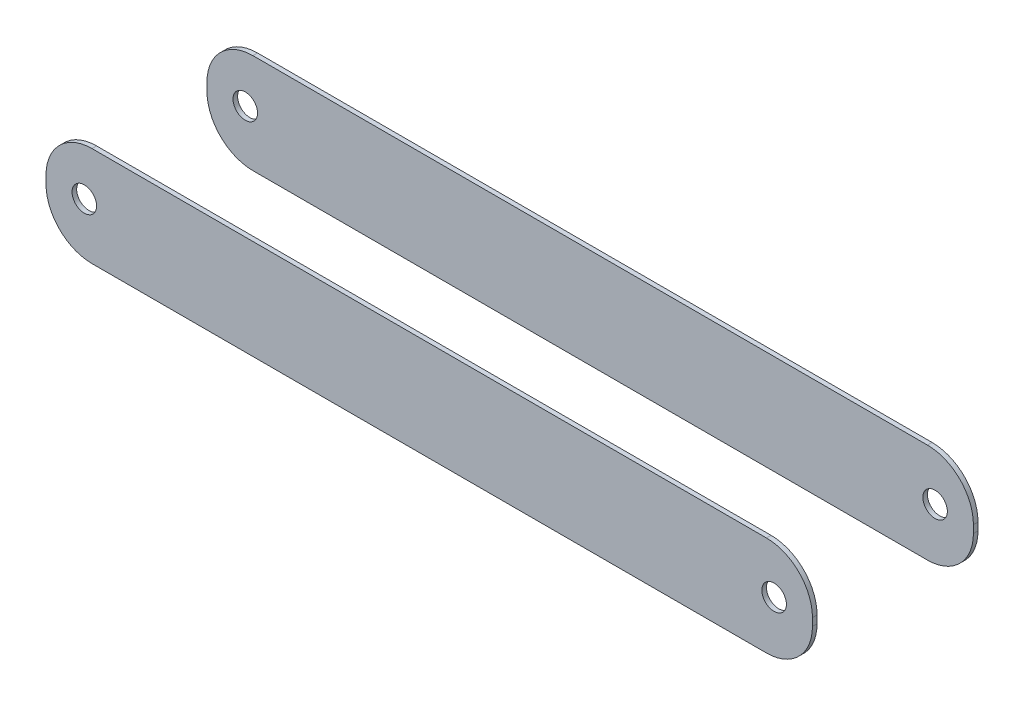
from build123d import *

# Parameters (mm, degrees)
SKETCH1_W           = 500
SKETCH1_H           = 108
BOSS_EXTRUDE1_DEPTH = 65
SKETCH3_W           = 500
SKETCH3_H           = 102
CUT_EXTRUDE1_DEPTH  = 158
SKETCH4_R           = 8
CUT_EXTRUDE2_DEPTH  = 158
FILLET1_R           = 30
FILLET3_R           = 30


with BuildPart() as part:
    # Sketch1 → Boss-Extrude1 (new body)
    with BuildSketch(Plane(origin=(0, 0, 0), x_dir=(1, 0, 0), z_dir=(0, 1, 0))):
        with Locations((16.180492252, 90.484958979)):
            Rectangle(SKETCH1_W, SKETCH1_H)
    extrude(amount=BOSS_EXTRUDE1_DEPTH)

    # Sketch3 → Cut-Extrude1 (cut)
    with BuildSketch(Plane.XZ):
        with Locations((16.180492252, -90.484958979)):
            Rectangle(SKETCH3_W, SKETCH3_H)
    extrude(amount=-CUT_EXTRUDE1_DEPTH, mode=Mode.SUBTRACT)


with BuildPart() as cut_extrude1_piece_1:
    # of the separate pieces the step leaves, piece 1, a body of its own (cut_extrude1_pieces)
    add(part.part.solids().sort_by_distance((-233.819507748, 0, -144.484958979))[0])


with BuildPart() as cut_extrude1_piece_2:
    # of the separate pieces the step leaves, piece 2, a body of its own (cut_extrude1_pieces)
    add(part.part.solids().sort_by_distance((-233.819507748, 0, -36.484958979))[0])


with BuildPart() as cut_extrude2_tool:
    # Sketch4 → Cut-Extrude2 (new body)
    with BuildSketch(Plane.XY.offset(-36.484958979)):
        with Locations((-208.819507748, 34)):
            Circle(SKETCH4_R)
        with Locations((241.180492252, 34)):
            Circle(SKETCH4_R)
    extrude(amount=-CUT_EXTRUDE2_DEPTH)


with BuildPart() as cut_extrude1_piece_1_1:
    add(cut_extrude1_piece_1.part)

    # Cut-Extrude2: cut by cut_extrude2_tool
    add(cut_extrude2_tool.part, mode=Mode.SUBTRACT)

    # Fillet1
    fillet1_edges = [cut_extrude1_piece_1_1.edges().sort_by_distance(p)[0] for p in [
        (-233.819507748, 65, -142.984958979),
        (-233.819507748, 0, -142.984958979),
        (266.180492252, 0, -142.984958979),
        (266.180492252, 65, -142.984958979),
    ]]
    fillet(fillet1_edges, radius=FILLET1_R)


with BuildPart() as cut_extrude1_piece_2_1:
    add(cut_extrude1_piece_2.part)

    # Cut-Extrude2: cut by cut_extrude2_tool
    add(cut_extrude2_tool.part, mode=Mode.SUBTRACT)

    # Fillet3
    fillet3_edges = [cut_extrude1_piece_2_1.edges().sort_by_distance(p)[0] for p in [
        (266.180492252, 0, -37.984958979),
        (266.180492252, 65, -37.984958979),
        (-233.819507748, 0, -37.984958979),
        (-233.819507748, 65, -37.984958979),
    ]]
    fillet(fillet3_edges, radius=FILLET3_R)


solid = Compound([cut_extrude1_piece_1_1.part, cut_extrude1_piece_2_1.part])
